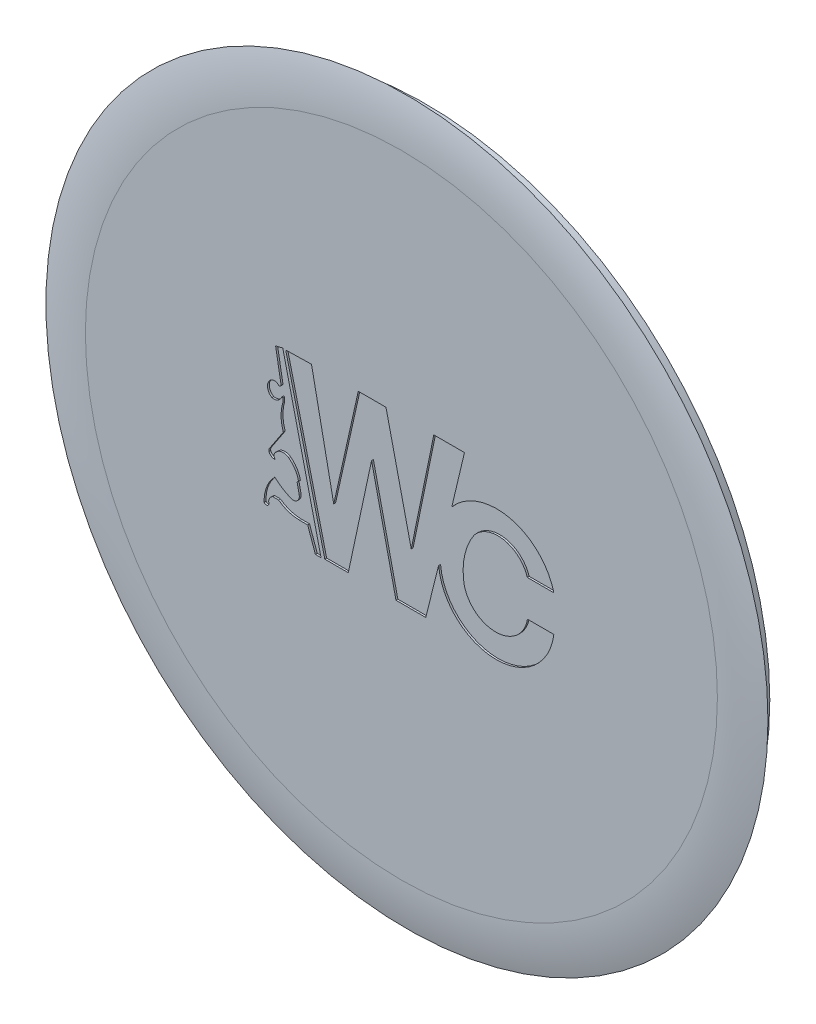
from build123d import *

# Parameters (mm, degrees)
SKETCH1_R           = 19.5
BOSS_EXTRUDE1_DEPTH = 0.3
SKETCH1_3_R         = 18.6
SKETCH1_3_R_2       = 18.3
BOSS_EXTRUDE2_DEPTH = 1
FILLET1_R           = 10
CUT_EXTRUDE1_START  = -0.1
CUT_EXTRUDE1_DEPTH  = 0.1


# Read off the part's stored shape, not the designer's step: Cut-Extrude1
with BuildPart() as part:
    # Sketch1 → Boss-Extrude1 (new body)
    with BuildSketch(Plane.XY):
        Circle(SKETCH1_R)
    extrude(amount=BOSS_EXTRUDE1_DEPTH)

    # Sketch1<3> → Boss-Extrude2 (add)
    with BuildSketch(Plane.XY):
        Circle(SKETCH1_3_R)
        Circle(SKETCH1_3_R_2, mode=Mode.SUBTRACT)
    extrude(amount=-BOSS_EXTRUDE2_DEPTH)

    # Fillet1
    # the kernel refuses this fillet: 10 mm, written as the material it takes off along each edge
    with BuildSketch(Plane(origin=(0, 0, 0.3), x_dir=(1, 0, 0), z_dir=(0, -1, 0))) as fillet1_piece_1:
        with BuildLine():
            CenterArc((17.068950844, -10), FILLET1_R, 75.930132252, 14.069867748)
            Line((17.068950844, 0), (17.068950844, 0.2))
            Line((17.068950844, 0.2), (19.5, 0.2))
            Line((19.5, 0.2), (19.7, 0))
            ThreePointArc((19.7, 0), (19.7, -0.15), (19.548620983, -0.106))
            Line((19.548620983, -0.106), (19.5, -0.3))
        make_face()
    revolve(axis=Axis((0, 0, 0.3), (0, 0, 1)), mode=Mode.SUBTRACT)

    # Cut-Extrude1 outline → Cut-Extrude1 (cut)
    with BuildSketch(Plane.XY.offset(0.3).offset(CUT_EXTRUDE1_START)):
        with BuildLine():
            Line((1.315411857, -4.122498151), (2.014314535, -1.338720024))
            ThreePointArc((2.014314535, -1.338720024), (5.071648244, -4.189541516), (8.236226494, -1.458256637))
            Line((8.236226494, -1.458256637), (6.810434555, -1.458256637))
            ThreePointArc((6.810434555, -1.458256637), (5.012044187, -2.913884745), (3.355418791, -1.298752119))
            ThreePointArc((3.355418791, -1.298752119), (3.437417537, -0.072322093), (3.940070016, 1.049370774))
            ThreePointArc((3.940070016, 1.049370774), (5.536779658, 1.617570868), (6.80295626, 0.491014238))
            Line((6.80295626, 0.491014238), (8.236226494, 0.491014238))
            ThreePointArc((8.236226494, 0.491014238), (5.861564417, 2.797023993), (2.721821376, 1.74882811))
            Line((2.721821376, 1.74882811), (3.407587296, 4.634399496))
            Line((3.407587296, 4.634399496), (1.750846599, 4.634399496))
            Line((1.750846599, 4.634399496), (0.532539724, -1.311746329))
            Line((0.532539724, -1.311746329), (-0.832013668, 4.634399496))
            Line((-0.832013668, 4.634399496), (-2.328745068, 4.634399496))
            Line((-2.328745068, 4.634399496), (-3.653616427, -1.303011789))
            Line((-3.653616427, -1.303011789), (-4.854525711, 4.634399496))
            Line((-4.854525711, 4.634399496), (-6.247187009, 4.603807508))
            Line((-6.247187009, 4.603807508), (-4.13707531, -4.122498151))
            Line((-4.13707531, -4.122498151), (-2.868545937, -4.122498151))
            Line((-2.868545937, -4.122498151), (-1.610862761, 1.75217424))
            Line((-1.610862761, 1.75217424), (-0.291169429, -4.122498151))
            Line((-0.291169429, -4.122498151), (1.315411857, -4.122498151))
        make_face()
        with BuildLine():
            Line((-6.937538905, -2.602863273), (-6.637674337, -2.602863273))
            ThreePointArc((-6.637674337, -2.602863273), (-6.120559929, -2.872899906), (-5.547687427, -2.983100592))
            Line((-5.547687427, -2.983100592), (-5.062190332, -2.983100592))
            Line((-5.062190332, -2.983100592), (-4.643328191, -4.157083976))
            Line((-4.643328191, -4.157083976), (-4.338702943, -4.157083976))
            Line((-4.338702943, -4.157083976), (-6.406435712, 4.616022013))
            Line((-6.406435712, 4.616022013), (-6.794480732, 4.524563708))
            Line((-6.794480732, 4.524563708), (-6.497707451, 2.844057166))
            ThreePointArc((-6.497707451, 2.844057166), (-6.543403682, 2.764133189), (-6.634976133, 2.773644958))
            ThreePointArc((-6.634976133, 2.773644958), (-6.812471334, 2.860826812), (-7.00818234, 2.832499724))
            ThreePointArc((-7.00818234, 2.832499724), (-7.232944109, 2.4137084), (-6.990239601, 2.005053843))
            ThreePointArc((-6.990239601, 2.005053843), (-6.671904577, 2.052546685), (-6.464198285, 2.298414239))
            Line((-6.464198285, 2.298414239), (-6.400014039, 2.298414239))
            Line((-6.400014039, 2.298414239), (-6.400014039, 2.081303951))
            ThreePointArc((-6.400014039, 2.081303951), (-6.496019237, 1.38621962), (-6.377516068, 0.694615526))
            Line((-6.377516068, 0.694615526), (-7.103342547, -0.4012317))
            ThreePointArc((-7.103342547, -0.4012317), (-7.155024922, -0.494114517), (-7.158413077, -0.600353898))
            ThreePointArc((-7.158413077, -0.600353898), (-7.020194568, -0.758643223), (-6.815959597, -0.808119916))
            ThreePointArc((-6.815959597, -0.808119916), (-6.877232982, -0.649384136), (-6.826115409, -0.487092826))
            Line((-6.826115409, -0.487092826), (-6.666005475, -0.342790453))
            ThreePointArc((-6.666005475, -0.342790453), (-6.364107135, -0.25949819), (-6.071279663, -0.37054899))
            ThreePointArc((-6.071279663, -0.37054899), (-5.738084346, -0.734492432), (-5.554908519, -1.192663322))
            Line((-5.554908519, -1.192663322), (-5.636587076, -1.257125772))
            Line((-5.636587076, -1.257125772), (-5.52013275, -1.803631749))
            ThreePointArc((-5.52013275, -1.803631749), (-5.60809608, -2.112628848), (-5.913172695, -2.213351306))
            ThreePointArc((-5.913172695, -2.213351306), (-6.401983276, -1.969270784), (-6.837380228, -1.639209304))
            ThreePointArc((-6.837380228, -1.639209304), (-7.277778062, -2.310157247), (-7.410559234, -3.101668811))
            ThreePointArc((-7.410559234, -3.101668811), (-7.217893073, -3.146992956), (-7.172568928, -2.954326795))
            ThreePointArc((-7.172568928, -2.954326795), (-7.105944543, -2.74456355), (-6.937538905, -2.602863273))
        make_face()
    extrude(amount=CUT_EXTRUDE1_DEPTH, mode=Mode.SUBTRACT)


solid = part.part
